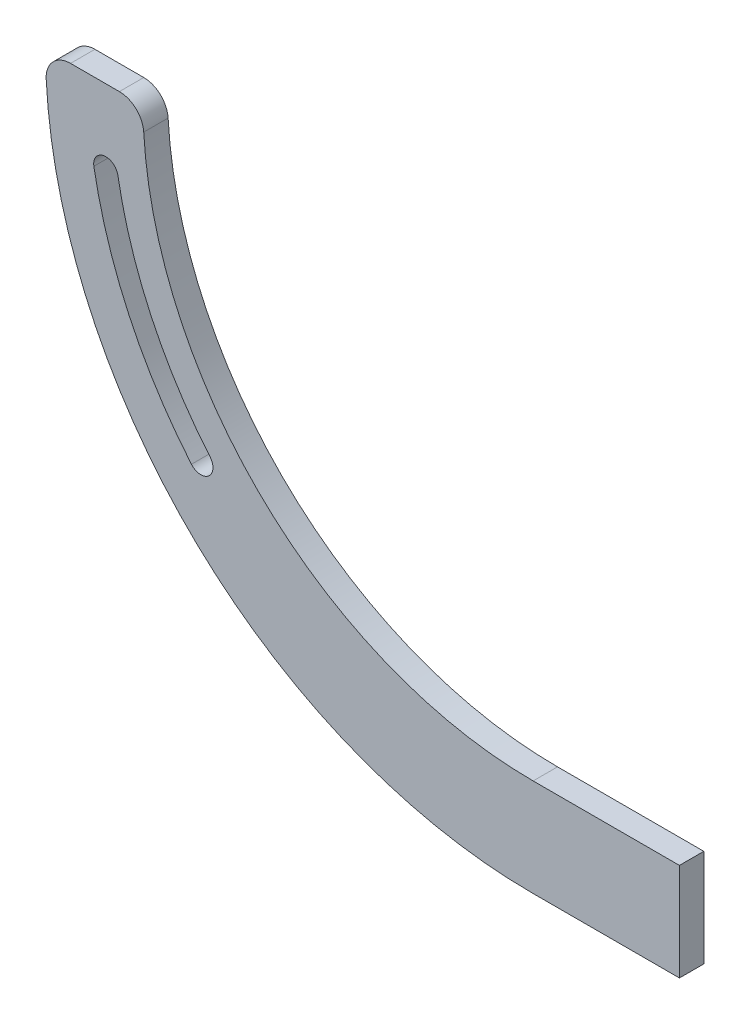
from build123d import *

# Parameters (mm, degrees)
BOSS_EXTRUDE1_DEPTH = 12.7
CUT_EXTRUDE1_REACH  = 361.435
FILLET1_R           = 12.7


with BuildPart() as part:
    # Sketch1 → Boss-Extrude1 (new body)
    with BuildSketch(Plane.XY):
        with BuildLine():
            Line((0, -203.2), (76.2, -203.2))
            Line((76.2, -203.2), (76.2, -254))
            Line((76.2, -254), (0, -254))
            ThreePointArc((0, -254), (-179.605122421, -179.605122421), (-254, 0))
            Line((-254, 0), (-203.2, 0))
            ThreePointArc((-203.2, 0), (-143.684097937, -143.684097937), (0, -203.2))
        make_face()
    extrude(amount=BOSS_EXTRUDE1_DEPTH)

    # Sketch2 → Cut-Extrude1 (cut, up to next)
    with BuildSketch(Plane.XY.offset(12.7), mode=Mode.PRIVATE) as cut_extrude1_sk1:
        with BuildLine():
            ThreePointArc((-228.818212932, -40.346824617), (-210.578894776, -98.19455128), (-177.988972939, -149.350481547))
            ThreePointArc((-177.988972939, -149.350481547), (-169.042889404, -150.133162439), (-168.260208511, -141.187078904))
            ThreePointArc((-168.260208511, -141.187078904), (-199.068785881, -92.827299356), (-216.311154469, -38.141492761))
            ThreePointArc((-216.311154469, -38.141492761), (-223.667349629, -32.990629458), (-228.818212932, -40.346824617))
        make_face()
    cut_extrude1_tool1 = extrude(cut_extrude1_sk1.sketch, amount=-CUT_EXTRUDE1_REACH, mode=Mode.PRIVATE) & part.part
    add(cut_extrude1_tool1.solids().sort_by_distance((-202.130817, -94.255148, 12.7))[0], mode=Mode.SUBTRACT)

    # Fillet1
    fillet1_edges = [part.edges().sort_by_distance(p)[0] for p in [
        (-203.2, 0, 6.35),
        (-254, 0, 6.35),
    ]]
    fillet(fillet1_edges, radius=FILLET1_R)


solid = part.part
